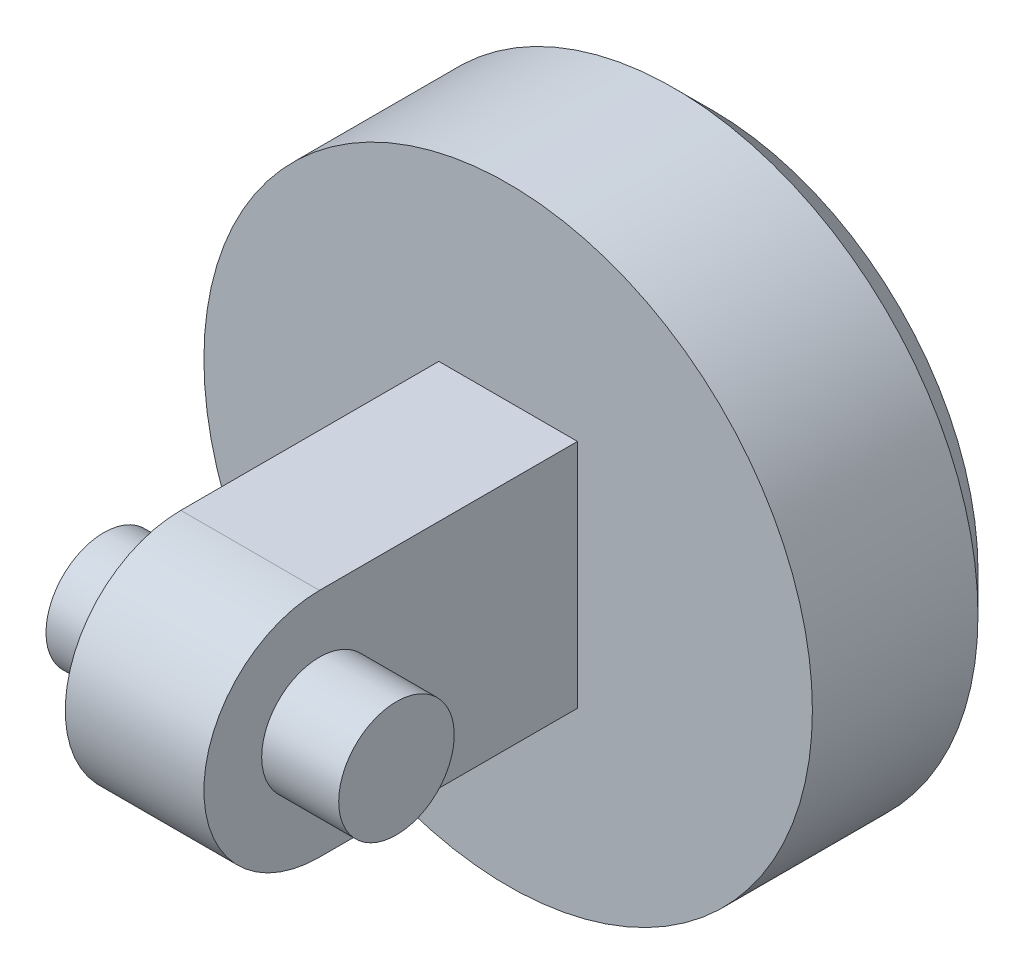
from build123d import *

# Parameters (mm, degrees)
SKETCH_1_R          = 7.9
EXTRUDE_1_DEPTH     = 5.3
SKETCH_2_W          = 3.6
SKETCH_2_H          = 6
EXTRUDE_2_DEPTH     = 9.7
CUT_EXTRUDE_START   = -3.6
CUT_EXTRUDE_1_DEPTH = 3.6
CHAMFER_1_SIZE      = 1
SKETCH_4_R          = 1.5
EXTRUDE_3_DEPTH     = 2


# Read off the part's stored shape, not the designer's step: 切除-拉伸1
with BuildPart() as part:
    # 草图1 → 凸台-拉伸1 (new body)
    with BuildSketch(Plane.XY):
        Circle(SKETCH_1_R)
    extrude(amount=EXTRUDE_1_DEPTH)

    # 草图2 → 凸台-拉伸2 (add)
    with BuildSketch(Plane.XY.offset(5.3)):
        Rectangle(SKETCH_2_W, SKETCH_2_H)
    extrude(amount=EXTRUDE_2_DEPTH)

    # 切除-拉伸1 outline → 切除-拉伸1 (cut)
    with BuildSketch(Plane.ZY.offset(1.8).offset(CUT_EXTRUDE_START)):
        with BuildLine():
            Line((15, 3), (12, 3))
            ThreePointArc((12, 3), (14.121320344, 2.121320344), (15, 0))
            Line((15, 0), (15, 3))
        make_face()
        with BuildLine():
            Line((15, -3), (15, 0))
            ThreePointArc((15, 0), (14.121320344, -2.121320344), (12, -3))
            Line((12, -3), (15, -3))
        make_face()
    extrude(amount=CUT_EXTRUDE_1_DEPTH, mode=Mode.SUBTRACT)

    # 倒角1
    chamfer_1_edges = [part.edges().sort_by_distance(p)[0] for p in [
        (-7.9, 0, 0),
    ]]
    chamfer(chamfer_1_edges, length=CHAMFER_1_SIZE)

    # 草图4 → 凸台-拉伸3 (add)
    with BuildSketch(Plane.ZY.offset(1.8)):
        with Locations(Location((12, 0, 0), (0, 0, 180))):
            Circle(SKETCH_4_R)
    extrude_3 = extrude(amount=EXTRUDE_3_DEPTH)

    # 镜向1: 凸台-拉伸3 across plane
    add(extrude_3.mirror(Plane(origin=(0, 0, 0), x_dir=(0, 0, 1), z_dir=(1, 0, 0))))


solid = part.part
